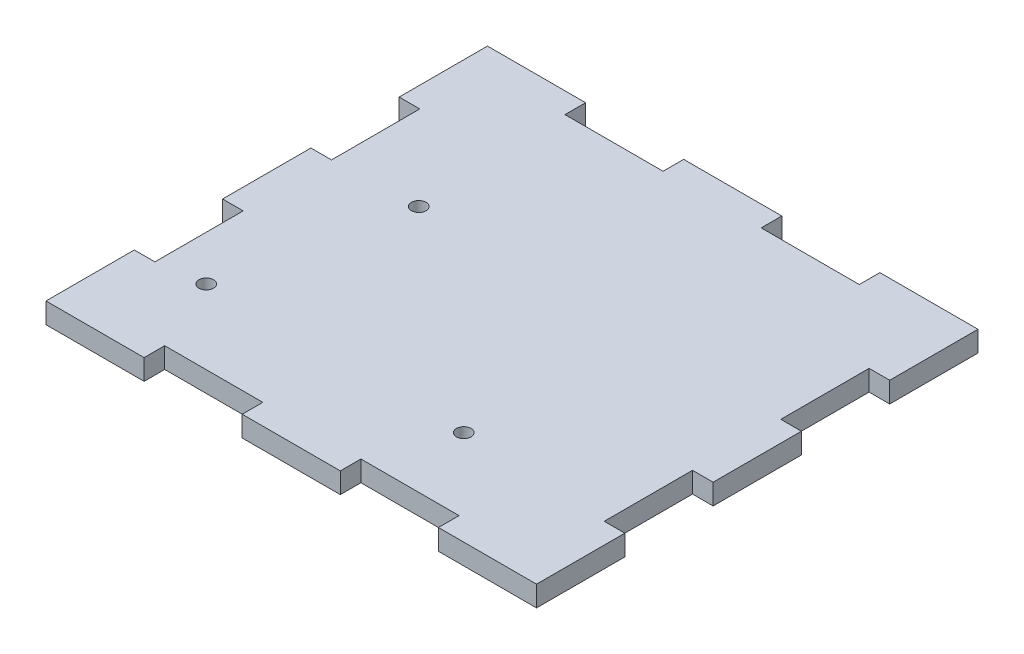
from build123d import *

# Parameters (mm, degrees)
SKETCH1_W           = 127
SKETCH1_H           = 114.3
BOSS_EXTRUDE1_DEPTH = 5.334
SKETCH2_W           = 5.334
SKETCH2_H           = 22.86
SKETCH2_W_2         = 25.4
SKETCH2_H_2         = 5.334
CUT_EXTRUDE1_DEPTH  = 86.596869429
SKETCH3_R           = 1.89865
CUT_EXTRUDE2_DEPTH  = 86.596869429
SKETCH4_R           = 1.89865
CUT_EXTRUDE3_DEPTH  = 86.596869429


with BuildPart() as part:
    # Sketch1 → Boss-Extrude1 (new body)
    with BuildSketch(Plane(origin=(0, 0, 0), x_dir=(1, 0, 0), z_dir=(0, 1, 0))):
        Rectangle(SKETCH1_W, SKETCH1_H)
    extrude(amount=BOSS_EXTRUDE1_DEPTH)

    # Sketch2 → Cut-Extrude1 (cut, through all)
    with BuildSketch(Plane(origin=(0, 5.334, 0), x_dir=(1, 0, 0), z_dir=(0, 1, 0))):
        with Locations((-60.833, -22.86)):
            Rectangle(SKETCH2_W, SKETCH2_H)
        with Locations((-60.833, 22.86)):
            Rectangle(SKETCH2_W, SKETCH2_H)
        with Locations((-25.4, 54.483)):
            Rectangle(SKETCH2_W_2, SKETCH2_H_2)
        with Locations((25.4, 54.483)):
            Rectangle(SKETCH2_W_2, SKETCH2_H_2)
        with Locations((60.833, 22.86)):
            Rectangle(SKETCH2_W, SKETCH2_H)
        with Locations((60.833, -22.86)):
            Rectangle(SKETCH2_W, SKETCH2_H)
        with Locations((25.4, -54.483)):
            Rectangle(SKETCH2_W_2, SKETCH2_H_2)
        with Locations((-25.4, -54.483)):
            Rectangle(SKETCH2_W_2, SKETCH2_H_2)
    extrude(amount=-CUT_EXTRUDE1_DEPTH, mode=Mode.SUBTRACT)

    # Sketch3 → Cut-Extrude2 (cut, through all)
    with BuildSketch(Plane(origin=(0, 5.334, 0), x_dir=(1, 0, 0), z_dir=(0, 1, 0))):
        with Locations((-46.568322948, -32.600738686)):
            Circle(SKETCH3_R)
        with Locations((20.106677052, -32.600738686)):
            Circle(SKETCH3_R)
    extrude(amount=-CUT_EXTRUDE2_DEPTH, mode=Mode.SUBTRACT)

    # Sketch4 → Cut-Extrude3 (cut, through all)
    with BuildSketch(Plane.XZ):
        with Locations((-36.408322948, -12.280738686)):
            Circle(SKETCH4_R)
    extrude(amount=-CUT_EXTRUDE3_DEPTH, mode=Mode.SUBTRACT)


solid = part.part
